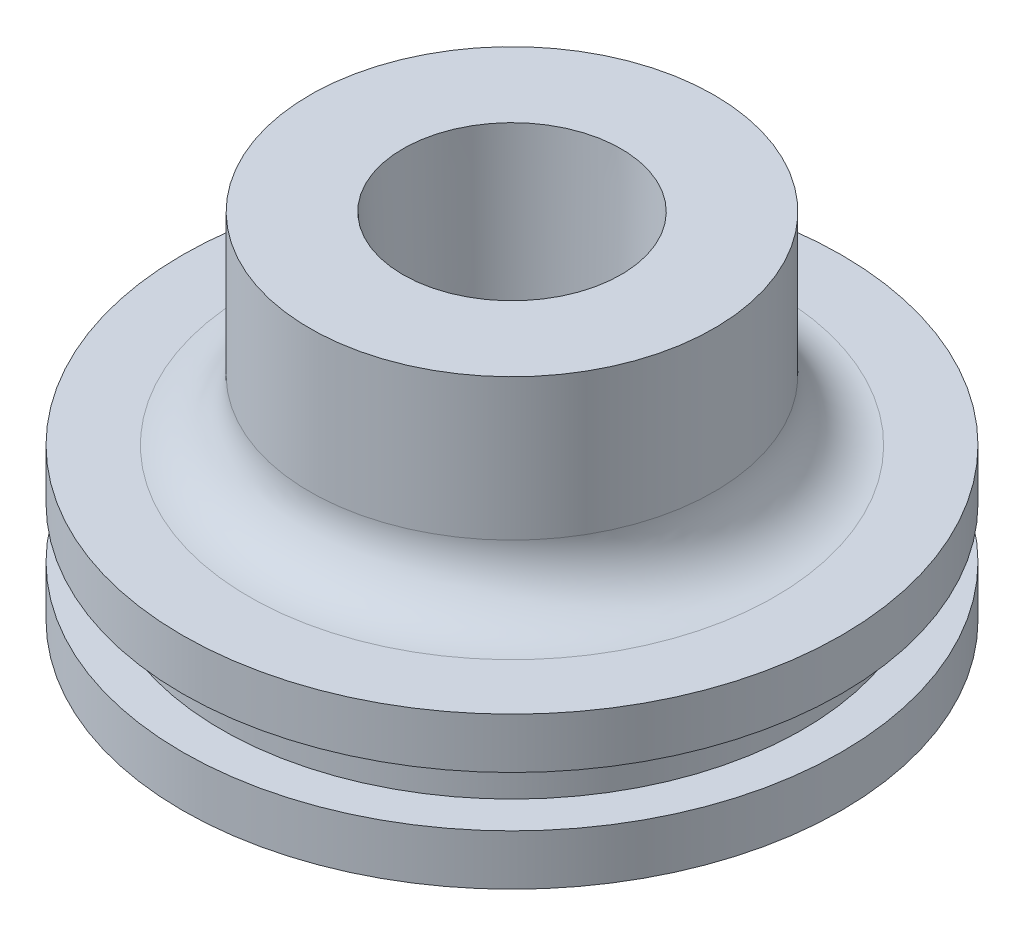
from build123d import *

# Parameters (mm, degrees)
PT_1_8_PRESSURE_HOLE_D = 3.175


with BuildPart() as part:
    # Sketch2 → base (revolve)
    with BuildSketch(Plane.XY):
        with BuildLine():
            Line((-20.701, 0), (-20.701, -3.175))
            Line((-20.701, -3.175), (-18.25625, -3.175))
            Line((-18.25625, -3.175), (-18.25625, -6.35))
            Line((-18.25625, -6.35), (-20.701, -6.35))
            Line((-20.701, -6.35), (-20.701, -9.525))
            Line((-20.701, -9.525), (0, -9.525))
            Line((0, -9.525), (0, 12.7))
            Line((0, 12.7), (-12.7, 12.7))
            Line((-12.7, 12.7), (-12.7, 3.81))
            ThreePointArc((-12.7, 3.81), (-13.815923164, 1.115923164), (-16.51, 0))
            Line((-16.51, 0), (-20.701, 0))
        make_face()
    revolve(axis=Axis((0, -9.525, 0), (0, 1, 0)))

    # Sketch11 → PT 1/4 NPT Tapped (revolve, cut)
    with BuildSketch(Plane(origin=(0, 12.7, 0), x_dir=(0, 0, 1), z_dir=(1, 0, 0))):
        Polygon((0, 0), (0, 16.042347279), (5.5626, 12.7), (5.5626, 9.906), (6.545173493, 9.906), (6.8544313, 0), align=None)
    revolve(axis=Axis((0, 19.05, 0), (0, -1, 0)), mode=Mode.SUBTRACT)

    # PT 1/8 Pressure hole (through all)
    with Locations(Plane(origin=(0, 12.7, 0), x_dir=(1, 0, 0), z_dir=(0, 1, 0))):
        with Locations((0, 0)):
            Hole(PT_1_8_PRESSURE_HOLE_D / 2)


solid = part.part
